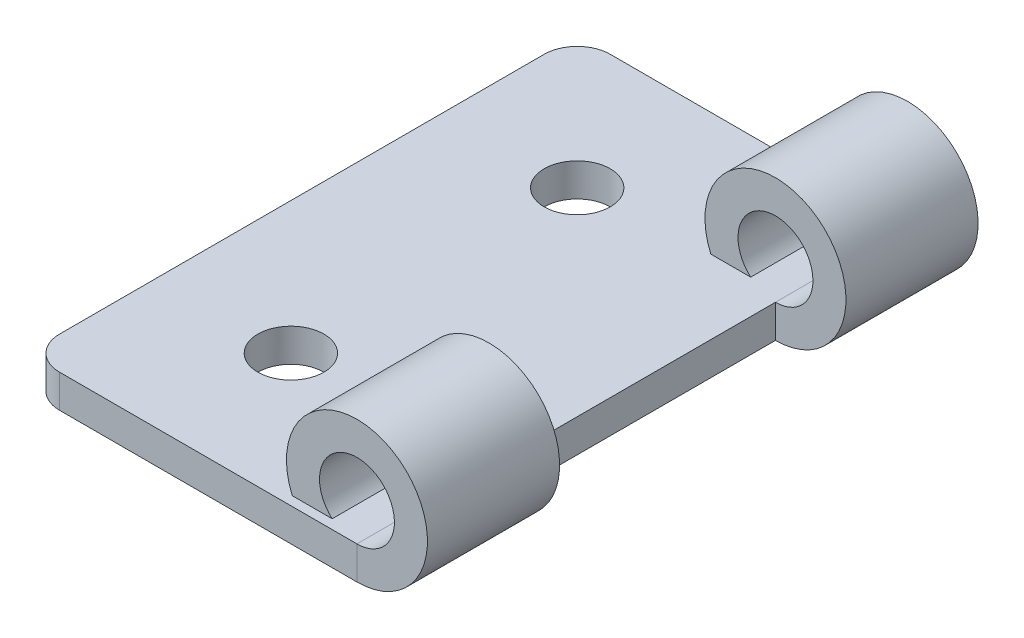
from build123d import *

# Parameters (mm, degrees)
SKETCH_1_W             = 15
SKETCH_1_H             = 25
SM_BASE_FLANGE_1_DEPTH = 1.5
SKETCH_6_R             = 1.5
CUT_EXTRUDE_1_DEPTH    = 10
SM_BASE_FLANGE_2_DEPTH = 25
SKETCH_10_W            = 13
SKETCH_10_H            = 7.865530851
CUT_EXTRUDE_3_DEPTH    = 32.308944409
SKETCH_11_W            = 2.711088342
SKETCH_11_H            = 13
CUT_EXTRUDE_5_DEPTH    = 10
FILLET_1_R             = 1.5


# Sheet-metal steps are written as plain solids
with BuildPart() as part:
    # Sketch 1 → 基体-法兰1 (new body)
    with BuildSketch(Plane(origin=(0, 0, 0), x_dir=(1, 0, 0), z_dir=(0, 1, 0))):
        with Locations((7.5, 12.5)):
            Rectangle(SKETCH_1_W, SKETCH_1_H)
    extrude(amount=-SM_BASE_FLANGE_1_DEPTH)

    # Sketch 6 → 切除-拉伸1 (cut)
    with BuildSketch(Plane(origin=(0, 0, 0), x_dir=(1, 0, 0), z_dir=(0, 1, 0))):
        with Locations(Location((6, 19, 0), (0, 0, 270))):
            Circle(SKETCH_6_R)
        with Locations(Location((6, 6, 0), (0, 0, 270))):
            Circle(SKETCH_6_R)
    extrude(amount=-CUT_EXTRUDE_1_DEPTH, mode=Mode.SUBTRACT)

    # 圆角1
    fillet_1_edges = [part.edges().sort_by_distance(p)[0] for p in [
        (0, -0.75, -25),
        (0, -0.75, 0),
    ]]
    fillet(fillet_1_edges, radius=FILLET_1_R)


with BuildPart() as body_2:
    # Sketch 7 → 基体-法兰2 (new body)
    with BuildSketch(Plane.XY):
        with BuildLine():
            Line((15, 0), (15, -1.5))
            ThreePointArc((15, -1.5), (16.755157486, 4.375709662), (12.064817597, 0.425361126))
            Line((12.064817597, 0.425361126), (13.875146347, 0.425361126))
            ThreePointArc((13.875146347, 0.425361126), (15.601296065, 3.290107871), (15, 0))
        make_face()
    extrude(amount=-SM_BASE_FLANGE_2_DEPTH)

    # 草图10 → 切除-拉伸3 (cut, through all)
    with BuildSketch(Plane.ZY):
        with Locations((-12.5, 3.932765426)):
            Rectangle(SKETCH_10_W, SKETCH_10_H)
    extrude(amount=-CUT_EXTRUDE_3_DEPTH, mode=Mode.SUBTRACT)

    # 草图11 → 切除-拉伸5 (cut)
    with BuildSketch(Plane(origin=(0, 0, 0), x_dir=(1, 0, 0), z_dir=(0, 1, 0))):
        with Locations((16.355544171, 12.5)):
            Rectangle(SKETCH_11_W, SKETCH_11_H)
    extrude(amount=-CUT_EXTRUDE_5_DEPTH, mode=Mode.SUBTRACT)


with BuildPart() as cut_extrude_5_piece_1:
    # of the separate pieces the step leaves, piece 1, a body of its own (cut_extrude_5_pieces)
    add(body_2.part.solids().sort_by_distance((12.064817597, 0.425361126, 0))[0])


with BuildPart() as cut_extrude_5_piece_2:
    # of the separate pieces the step leaves, piece 2, a body of its own (cut_extrude_5_pieces)
    add(body_2.part.solids().sort_by_distance((15, -1.5, -19))[0])


solid = Compound([part.part, cut_extrude_5_piece_1.part, cut_extrude_5_piece_2.part])
